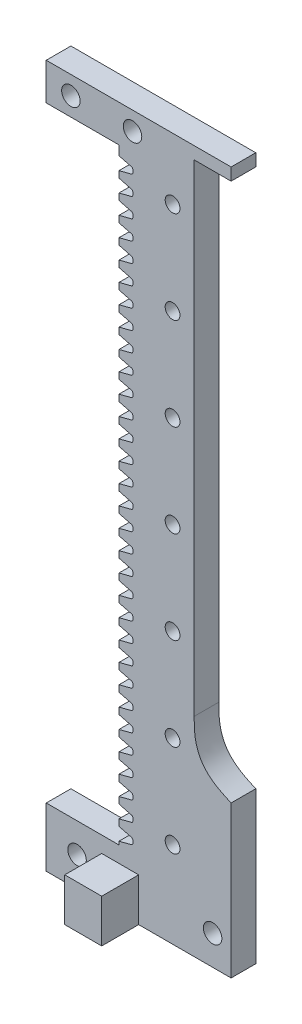
from build123d import *

# Parameters (mm, degrees)
EXTRUDECI_DEPTH               = 2
EXTRUDECI_DEPTH_BACK          = 2
SKETCHCI_M_STRSKETCHNAME_W    = 12.199999985
SKETCHCI_M_STRSKETCHNAME_H    = 97.389370798
TOOTHEXTRUDECUTSPURGEAR_DEPTH = 2
PATTERNSPURGEAR_COUNT         = 31
PATTERNSPURGEAR_PITCH         = 3.141592654
SKETCH1_R                     = 1.2
CUT_EXTRUDE1_DEPTH            = 30
SKETCH2_R                     = 1.5
BOSS_EXTRUDE1_DEPTH           = 4
SKETCH3_R                     = 1.5
BOSS_EXTRUDE2_DEPTH           = 4
FILLET1_START                 = -2
FILLET1_DEPTH                 = 4
SKETCH6_W                     = 6
SKETCH6_H                     = 7
BOSS_EXTRUDE4_DEPTH           = 6


with BuildPart() as part:
    # SketchCI.m_strSketchName → ExtrudeCI (new, two sides: drawn at the far end of the back side and taken through both)
    with BuildSketch(Plane.XY.offset(-EXTRUDECI_DEPTH_BACK)):
        with Locations((5.100000008, -47.123889096)):
            Rectangle(SKETCHCI_M_STRSKETCHNAME_W, SKETCHCI_M_STRSKETCHNAME_H)
    extrude(amount=EXTRUDECI_DEPTH + EXTRUDECI_DEPTH_BACK)

    # SketchToothSpurGear → ToothExtrudeCutSpurGear (cut, symmetric)
    with BuildSketch(Plane.XY):
        with BuildLine():
            Line((-0.999999985, 1.044015732), (-0.999999985, -1.044015732))
            Line((-0.999999985, -1.044015732), (1.025913986, -0.520078755))
            ThreePointArc((1.025913986, -0.520078755), (1.188006854, -0.413299648), (1.250799981, -0.229634467))
            Line((1.250799981, -0.229634467), (1.250799981, 0.229634467))
            ThreePointArc((1.250799981, 0.229634467), (1.188006854, 0.413299648), (1.025913986, 0.520078755))
            Line((1.025913986, 0.520078755), (-0.999999985, 1.044015732))
        make_face()
    toothextrudecutspurgear = extrude(amount=TOOTHEXTRUDECUTSPURGEAR_DEPTH, both=True, mode=Mode.SUBTRACT)

    # PatternSpurGear: ToothExtrudeCutSpurGear ×31
    with Locations(*[(0, -i * PATTERNSPURGEAR_PITCH, 0) for i in range(1, PATTERNSPURGEAR_COUNT)]):
        add(toothextrudecutspurgear, mode=Mode.SUBTRACT)

    # Sketch1 → Cut-Extrude1 (cut)
    with BuildSketch(Plane.XY.offset(2)):
        with Locations((7.7, -91.429203697)):
            Circle(SKETCH1_R)
        with Locations((7.7, -76.429203697)):
            Circle(SKETCH1_R)
        with Locations((7.7, -61.429203697)):
            Circle(SKETCH1_R)
        with Locations((7.7, -46.429203697)):
            Circle(SKETCH1_R)
        with Locations((7.7, -31.429203697)):
            Circle(SKETCH1_R)
        with Locations((7.7, -16.429203697)):
            Circle(SKETCH1_R)
        with Locations((7.7, -1.429203697)):
            Circle(SKETCH1_R)
    extrude(amount=-CUT_EXTRUDE1_DEPTH, mode=Mode.SUBTRACT)

    # Sketch2 → Boss-Extrude1 (add, through all)
    with BuildSketch(Plane.XY.offset(2)):
        Polygon((-0.999999985, 1.570796303), (-0.999999985, 2.570796303), (-12.799999985, 2.570796303), (-12.799999985, 8.570796303), (17.200000015, 8.570796303), (17.200000015, 6.570796303), (11.2, 6.570796303), (11.2, 1.570796303), align=None)
        with Locations((-8.799999985, 5.570796303)):
            Circle(SKETCH2_R, mode=Mode.SUBTRACT)
        with Locations((1.200000015, 5.570796303)):
            Circle(SKETCH2_R, mode=Mode.SUBTRACT)
    extrude(amount=-BOSS_EXTRUDE1_DEPTH)

    # Sketch3 → Boss-Extrude2 (add, through all)
    with BuildSketch(Plane.XY.offset(2)):
        Polygon((-0.999999985, -95.818574495), (-12.799999985, -95.818574495), (-12.799999985, -105.418574495), (17.200000015, -105.418574495), (17.200000015, -95.818574495), (17.200000015, -80.818574495), (11.200000015, -80.818574495), (11.200000015, -95.818574495), align=None)
        with Locations((-7.799999985, -100.618574495)):
            Circle(SKETCH3_R, mode=Mode.SUBTRACT)
        with Locations((14.200000015, -100.618574495)):
            Circle(SKETCH3_R, mode=Mode.SUBTRACT)
    extrude(amount=-BOSS_EXTRUDE2_DEPTH)

    # Fillet1: read off the stored shape, not the designer's step
    # Fillet1 outline → Fillet1 (add)
    with BuildSketch(Plane.XY.offset(FILLET1_START)):
        with BuildLine():
            add(Edge.make_bspline(
                [(11.2, -71.653423099), (11.2, -72.815400764), (11.2, -73.977378429), (11.543379815, -76.567637831), (12.833399739, -78.53817581), (15.070059771, -79.888992367), (16.135029893, -80.353783431), (17.200000015, -80.818574495)],
                knots=[0, 0, 0, 0, 0, 0, 0.5, 0.5, 1, 1, 1, 1, 1, 1], degree=5))
            Line((11.2, -71.653423099), (11.2, -80.818574495))
            Line((11.2, -80.818574495), (17.200000015, -80.818574495))
        make_face()
    extrude(amount=FILLET1_DEPTH)

    # Sketch6 → Boss-Extrude4 (add)
    with BuildSketch(Plane.XY.offset(2)):
        with Locations((-0.799999985, -101.918574495)):
            Rectangle(SKETCH6_W, SKETCH6_H)
    extrude(amount=BOSS_EXTRUDE4_DEPTH)


solid = part.part
